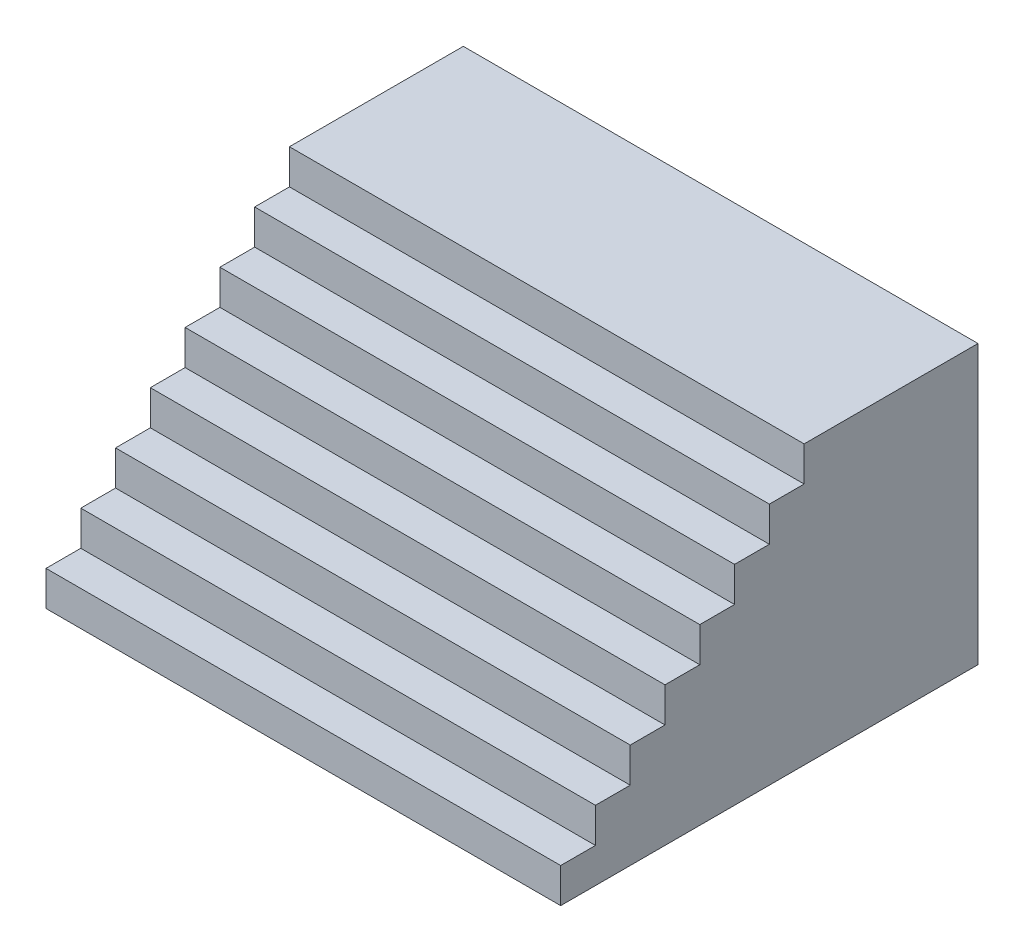
from build123d import *

# Parameters (mm, degrees)
BOSS_EXTRUDE2_DEPTH = 3700


with BuildPart() as part:
    # 3DSketch1 → Boss-Extrude2 (new body)
    with BuildSketch(Plane(origin=(1850, -1000, 0), x_dir=(0, 0.0830454798537399, 0.9965457582448797), z_dir=(-1, 0, 0))):
        Polygon((0, 0), (166.090959707, 1993.09151649), (1411.773157514, 1889.284666673), (1391.01178755, 1640.148227111), (1640.148227111, 1619.386857148), (1619.386857148, 1370.250417587), (1868.523296709, 1349.489047623), (1847.761926746, 1100.352608062), (2096.898366307, 1079.591238099), (2076.136996343, 830.454798537), (2325.273435905, 809.693428574), (2304.512065941, 560.556989013), (2553.648505503, 539.795619049), (2532.887135539, 290.659179488), (2782.0235751, 269.897809525), (2761.262205137, 20.761369963), (3010.398644698, 0), (2989.637274735, -249.136439561), align=None)
    extrude(amount=BOSS_EXTRUDE2_DEPTH)


solid = part.part
